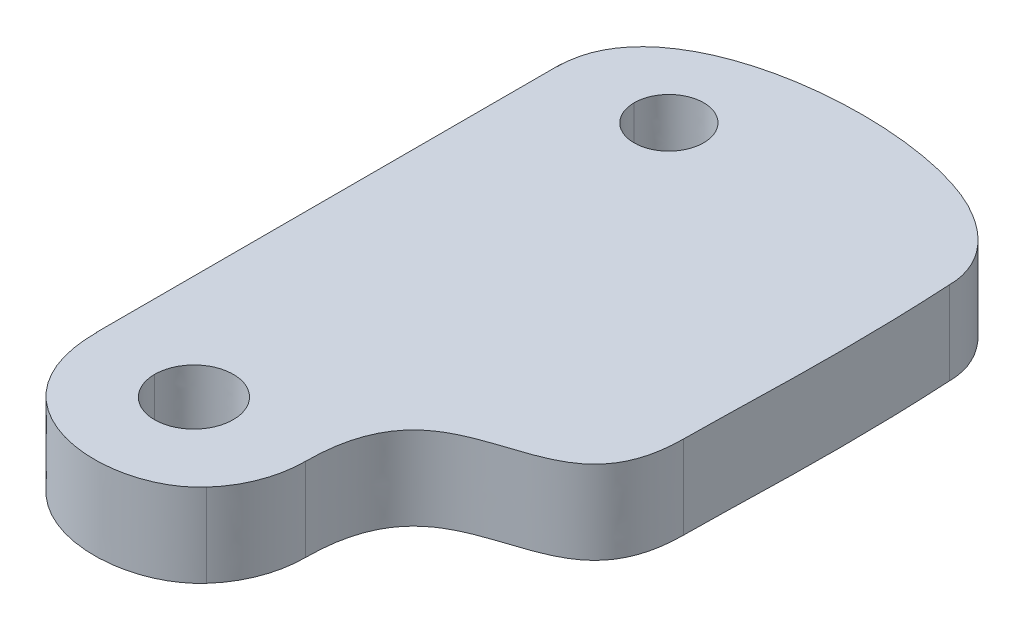
from build123d import *

# Parameters (mm, degrees)
BOSS_EXTRUDE1_DEPTH = 3.175


with BuildPart() as part:
    # Sketch1 → Boss-Extrude1 (new body)
    with BuildSketch(Plane(origin=(0, 0, 0), x_dir=(1, 0, 0), z_dir=(0, 1, 0))):
        with BuildLine():
            Line((-7.39599017, 7.861539782), (-7.40608976, 8.047333881))
            Line((-7.40608976, 8.047333881), (-7.40608976, -9.667484989))
            Line((-7.40608976, -9.667484989), (-7.395990171, -9.667484989))
            add(Edge.make_bspline(
                [(-7.395990171, -9.667484989), (-7.419503888, -14.359254774), (-2.097253946, -14.824833848), (-0.202449986, -12.688104045)],
                knots=[3, 3, 3, 3, 4, 4, 4, 4], degree=3))
            add(Edge.make_bspline(
                [(-0.202449986, -12.688104045), (0.461159365, -11.962741381), (0.834200784, -10.97906007), (0.834200784, -9.953266472)],
                knots=[4, 4, 4, 4, 5, 5, 5, 5], degree=3))
            add(Edge.make_bspline(
                [(0.834200784, -9.953266472), (0.847614911, -3.759244356), (7.276744818, -7.46221529), (7.299751606, -2.008967061)],
                knots=[5, 5, 5, 5, 6, 6, 6, 6], degree=3))
            add(Edge.make_bspline(
                [(7.299751606, -2.008967061), (7.310026672, 0.456281555), (7.523736335, 3.752134489), (7.276744819, 8.147321264)],
                knots=[6, 6, 6, 6, 7, 7, 7, 7], degree=3))
            add(Edge.make_bspline(
                [(7.276744819, 8.147321264), (7.276744819, 9.173114862), (6.611731664, 10.156991498), (5.428753823, 10.882158837)],
                knots=[7, 7, 7, 7, 8, 8, 8, 8], degree=3))
            add(Edge.make_bspline(
                [(5.428753823, 10.882158837), (2.050830927, 13.01888864), (-7.437772837, 12.553309567), (-7.39599017, 7.861539782)],
                knots=[8, 8, 8, 8, 9, 9, 9, 9], degree=3))
        make_face()
        with BuildLine():
            add(Edge.make_bspline(
                [(-4.735918052, 8.147321264), (-4.735918052, 8.879012492), (-4.143746727, 9.472276177), (-3.413359199, 9.472276177), (-2.682796195, 9.472276177), (-2.090624871, 8.879012492), (-2.090624871, 8.147321264)],
                knots=[2, 2, 2, 2, 3, 3, 3, 4, 4, 4, 4], degree=3))
            add(Edge.make_bspline(
                [(-2.090624871, 8.147321264), (-2.090624871, 7.415610504), (-2.682796196, 6.822112428), (-3.413183724, 6.822112428), (-4.143746727, 6.822112428), (-4.735918052, 7.415610505), (-4.735918052, 8.147321264)],
                knots=[0, 0, 0, 0, 1, 1, 1, 2, 2, 2, 2], degree=3))
        make_face(mode=Mode.SUBTRACT)
        with BuildLine():
            add(Edge.make_bspline(
                [(-3.413183724, -11.453467879), (-2.586265173, -11.453467879), (-1.915812278, -10.781663606), (-1.915812278, -9.953266472)],
                knots=[3, 3, 3, 3, 4, 4, 4, 4], degree=3))
            add(Edge.make_bspline(
                [(-1.915812278, -9.953266472), (-1.915812278, -9.124849805), (-2.586265173, -8.453006467), (-3.413183724, -8.453006467), (-4.240082778, -8.453006467), (-4.910535674, -9.124849805), (-4.910535674, -9.953071146)],
                knots=[0, 0, 0, 0, 1, 1, 1, 2, 2, 2, 2], degree=3))
            add(Edge.make_bspline(
                [(-4.910535674, -9.953071146), (-4.910730647, -10.781663606), (-4.240082778, -11.453272553), (-3.413183724, -11.453467879)],
                knots=[2, 2, 2, 2, 3, 3, 3, 3], degree=3))
        make_face(mode=Mode.SUBTRACT)
    extrude(amount=BOSS_EXTRUDE1_DEPTH)


solid = part.part
